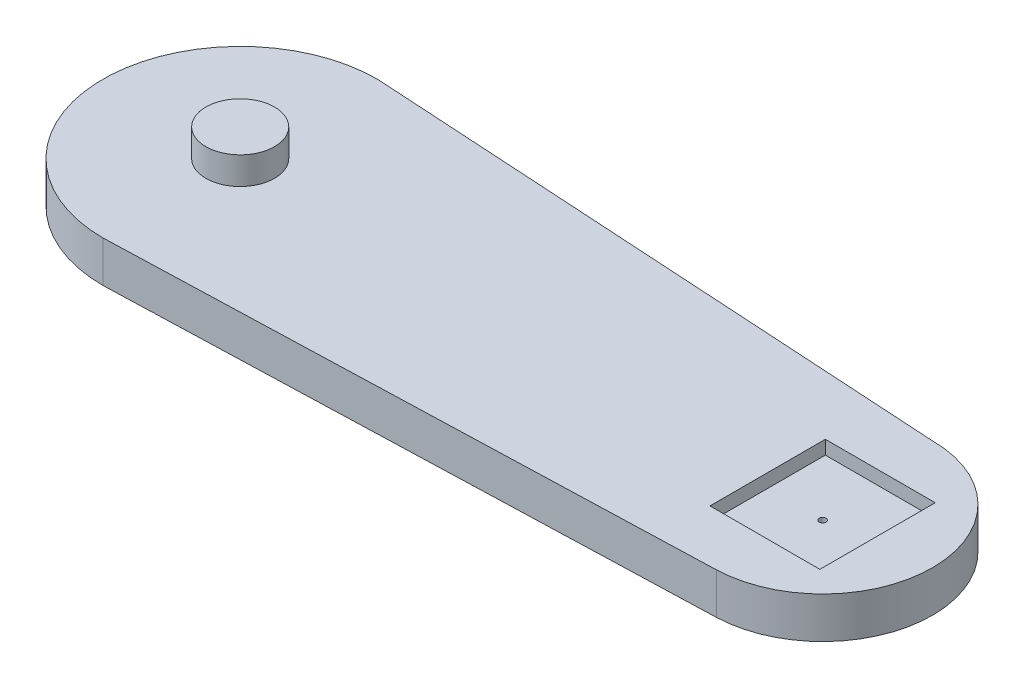
from build123d import *

# Parameters (mm, degrees)
CROQUIS1_R              = 1.25
SALIENTE_EXTRUIR1_DEPTH = 15
CROQUIS2_R              = 12.5
SALIENTE_EXTRUIR2_DEPTH = 10
CROQUIS3_R              = 11
CORTAR_EXTRUIR1_DEPTH   = 5
CROQUIS4_W              = 40
CROQUIS4_H              = 42
CORTAR_EXTRUIR2_DEPTH   = 5


with BuildPart() as part:
    # Croquis1 → Saliente-Extruir1 (new body)
    with BuildSketch(Plane(origin=(0, 0, 0), x_dir=(1, 0, 0), z_dir=(0, 1, 0))):
        with BuildLine():
            Line((0, 50), (215, 37.002241847))
            ThreePointArc((215, 37.002241847), (254.994732146, -2.34860444), (216.298136444, -42.976688126))
            Line((216.298136444, -42.976688126), (0, -50))
            ThreePointArc((0, -50), (-50, 0), (0, 50))
        make_face()
        Circle(CROQUIS1_R, mode=Mode.SUBTRACT)
        with Locations((215, -2.997758153)):
            Circle(CROQUIS1_R, mode=Mode.SUBTRACT)
    extrude(amount=SALIENTE_EXTRUIR1_DEPTH)

    # Croquis2 → Saliente-Extruir2 (add)
    with BuildSketch(Plane(origin=(0, 15, 0), x_dir=(1, 0, 0), z_dir=(0, 1, 0))):
        Circle(CROQUIS2_R)
    extrude(amount=SALIENTE_EXTRUIR2_DEPTH)

    # Croquis3 → Cortar-Extruir1 (cut)
    with BuildSketch(Plane(origin=(0, 0, 0), x_dir=(-1, 0, 0), z_dir=(0, -1, 0))):
        Circle(CROQUIS3_R)
    extrude(amount=-CORTAR_EXTRUIR1_DEPTH, mode=Mode.SUBTRACT)

    # Croquis4 → Cortar-Extruir2 (cut)
    with BuildSketch(Plane(origin=(0, 15, 0), x_dir=(1, 0, 0), z_dir=(0, 1, 0))):
        with Locations((215, -2.997758153)):
            Rectangle(CROQUIS4_W, CROQUIS4_H)
    extrude(amount=-CORTAR_EXTRUIR2_DEPTH, mode=Mode.SUBTRACT)


solid = part.part
